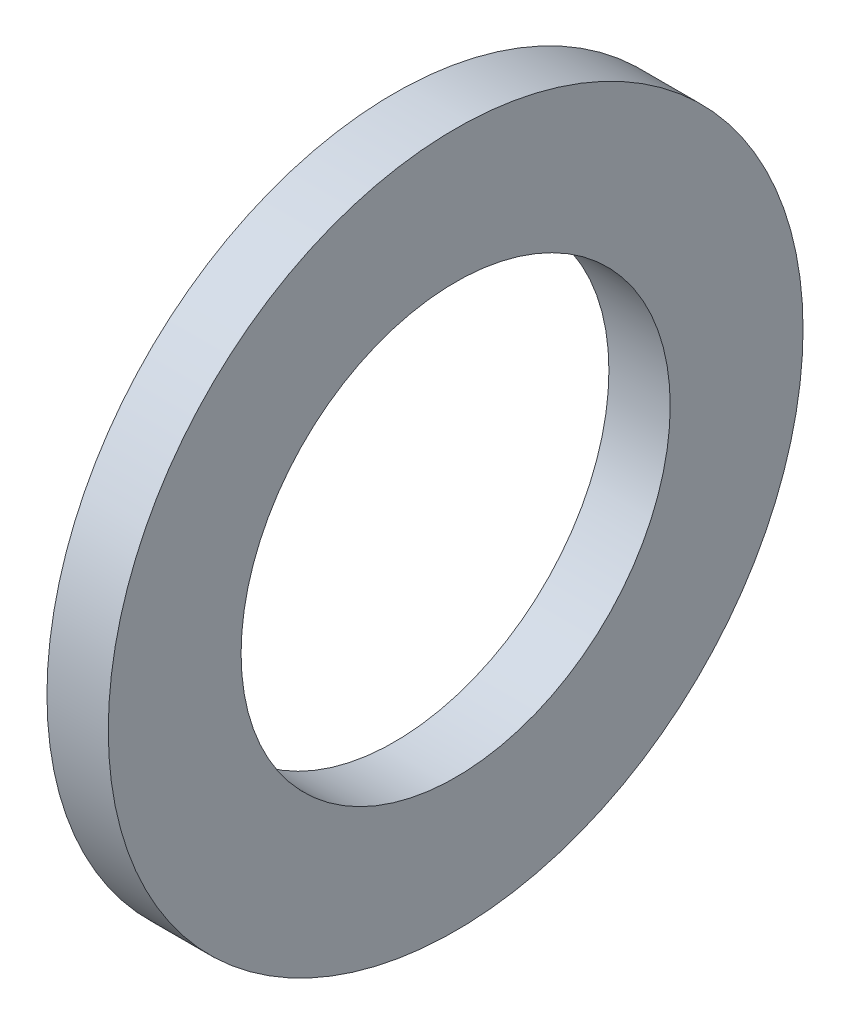
from build123d import *

# Parameters (mm, degrees)
SKETCH1_W = 3
SKETCH1_H = 6.5


with BuildPart() as part:
    # Sketch1 → Base-Revolve (revolve)
    with BuildSketch(Plane.XY):
        with Locations((-1.5, 13.75)):
            Rectangle(SKETCH1_W, SKETCH1_H)
    revolve(axis=Axis((-34.925, 0, 0), (1, 0, 0)))


solid = part.part
